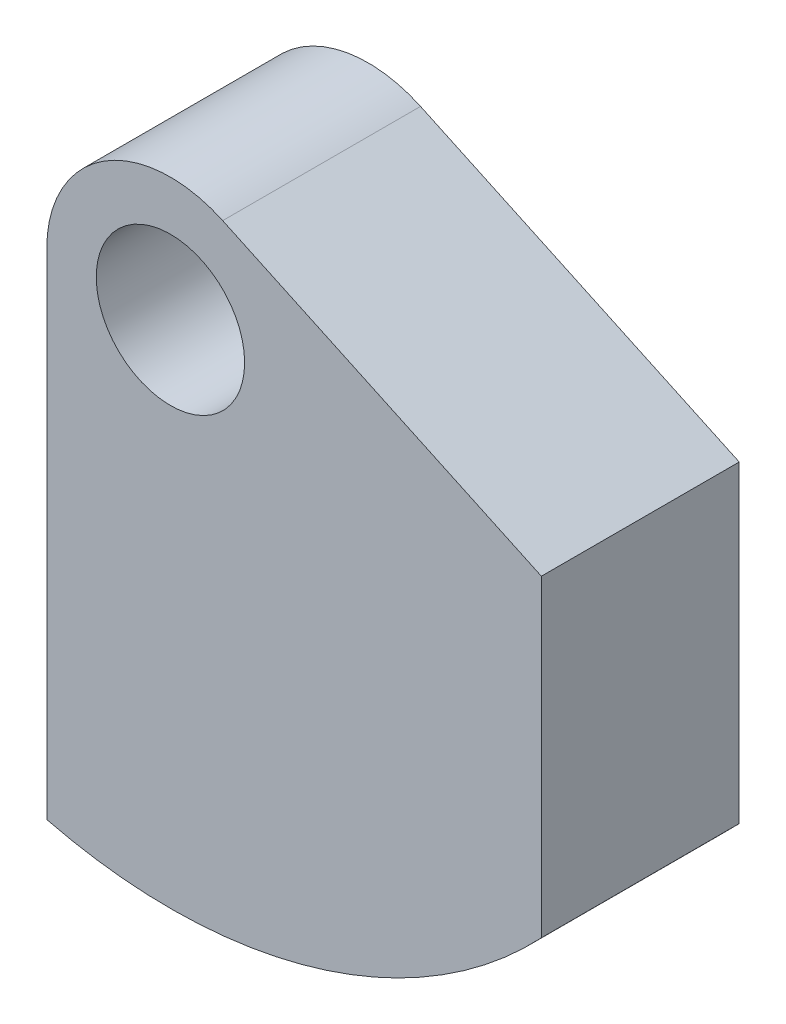
from build123d import *

# Parameters (mm, degrees)
SKETCH_1_R          = 1.5
EXTRUDE_1_DEPTH     = 4
CUT_EXTRUDE_1_DEPTH = 15.988554976


with BuildPart() as part:
    # Эскиз1 → Бобышка-Вытянуть1 (new body)
    with BuildSketch(Plane.XY):
        with BuildLine():
            Line((10.119623525, -1.96041315), (1.056545654, 2.265769468))
            ThreePointArc((1.056545654, 2.265769468), (-1.343249021, 2.108478615), (-2.5, 0))
            Line((-2.5, 0), (-2.5, -10))
            ThreePointArc((-2.5, -10), (5.538357595, -8.693480037), (10.119623525, -1.96041315))
        make_face()
        Circle(SKETCH_1_R, mode=Mode.SUBTRACT)
    extrude(amount=EXTRUDE_1_DEPTH)

    # Эскиз2 → Вырез-Вытянуть1 (cut, through all)
    with BuildSketch(Plane.XY.offset(4)):
        with BuildLine():
            Line((7.5, -0.738862639), (7.5, -7.071067812))
            ThreePointArc((7.5, -7.071067812), (9.172921075, -4.701863348), (10.119623525, -1.96041315))
            Line((10.119623525, -1.96041315), (7.5, -0.738862639))
        make_face()
    extrude(amount=-CUT_EXTRUDE_1_DEPTH, mode=Mode.SUBTRACT)


solid = part.part
